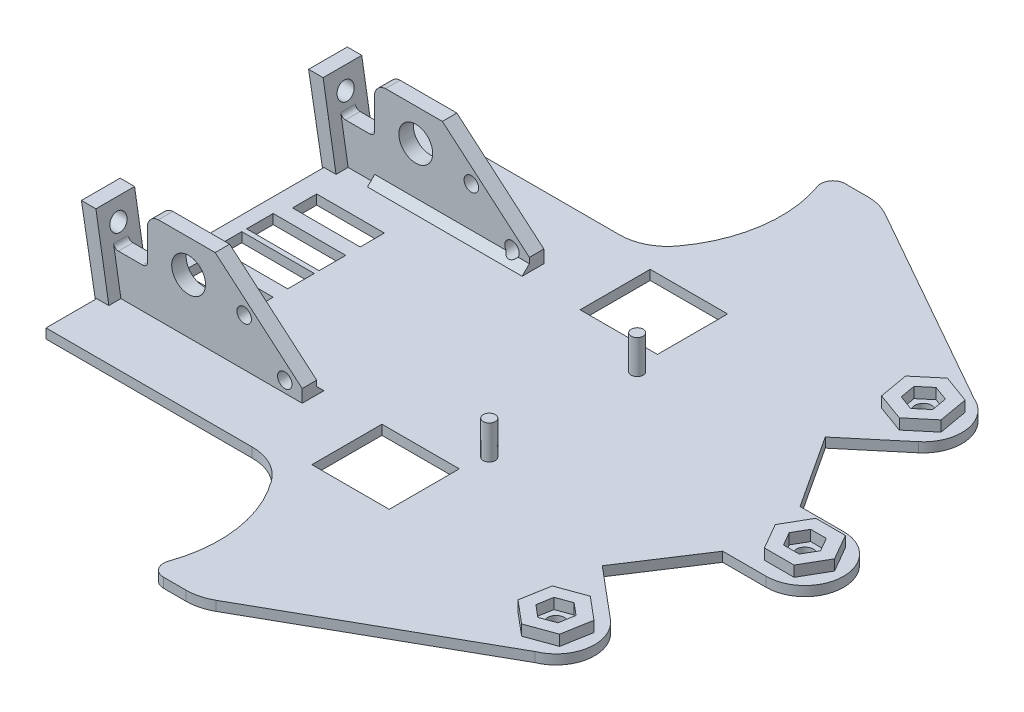
from build123d import *

# Parameters (mm, degrees)
ESBO_O1_R                  = 1.75
ESBO_O1_W                  = 16
ESBO_O1_H                  = 14.5
RESSALTO_EXTRUS_O1_DEPTH   = 2
RESSALTO_EXTRUS_O9_DEPTH   = 2.2
ESBO_O3_W                  = 2.5
ESBO_O3_H                  = 8
RESSALTO_EXTRUS_O3_DEPTH   = 9
ESBO_O3_3_W                = 2.5
ESBO_O3_3_H                = 8
RESSALTO_EXTRUS_O7_DEPTH   = 16
RESSALTO_EXTRUS_O8_DEPTH   = 8
RESSALTO_EXTRUS_O10_DEPTH  = 8
RESSALTO_EXTRUS_O4_START   = -16
ESBO_O4_R                  = 3.5
ESBO_O4_R_2                = 1.5
RESSALTO_EXTRUS_O4_DEPTH   = 3
CHANFRO1_SIZE              = 1.5
RESSALTO_EXTRUS_O15_DEPTH  = 2
FILETE2_R                  = 2.5
CHANFRO1_OF_ESPELHAR1_SIZE = 1.5
FILETE2_OF_ESPELHAR1_R     = 2.5
FILETE3_R                  = 10
CORTE_EXTRUS_O1_REACH      = 146.466
ESBO_O6_R                  = 1.75
CORTE_EXTRUS_O3_DEPTH      = 8
CORTE_EXTRUS_O4_DEPTH      = 8
RESSALTO_EXTRUS_O14_REACH  = 141.754
ESBO_O18_W                 = 3
ESBO_O18_H                 = 8.25
FILETE1_R                  = 1
ESBO_O8_R                  = 1.25
RESSALTO_EXTRUS_O6_DEPTH   = 7
CORTE_EXTRUS_O2_REACH      = 148.367
ESBO_O9_W                  = 14
ESBO_O9_H                  = 5
ESBO_O9_W_2                = 15
ESBO_O9_H_2                = 5.5
ESBO_O20_W                 = 2.5
ESBO_O20_H                 = 9
CORTE_EXTRUS_O5_DEPTH      = 31


with BuildPart() as part:
    # Esboço1 → Ressalto-extrusão1 (new body)
    with BuildSketch(Plane(origin=(0, 0, 0), x_dir=(1, 0, 0), z_dir=(0, 1, 0))):
        with BuildLine():
            Line((93.054209385, 38), (0, 38))
            Line((0, 38), (0, -38))
            Line((0, -38), (93.054209385, -38))
            Line((93.054209385, -38), (100.357699123, -44.128355545))
            ThreePointArc((100.357699123, -44.128355545), (111.628355545, -43.142300877), (110.642300877, -31.871644455))
            Line((110.642300877, -31.871644455), (100.149693398, -23.067301389))
            Line((100.149693398, -23.067301389), (110, -8))
            Line((110, -8), (119, -8))
            ThreePointArc((119, -8), (127, 0), (119, 8))
            Line((119, 8), (110, 8))
            Line((110, 8), (100.148586591, 23.066372668))
            Line((100.148586591, 23.066372668), (110.642300877, 31.871644455))
            ThreePointArc((110.642300877, 31.871644455), (111.628355545, 43.142300877), (100.357699123, 44.128355545))
            Line((100.357699123, 44.128355545), (93.054209385, 38))
        make_face()
        with Locations(Location((105.5, -38, 0), (0, 0, 270))):
            Circle(ESBO_O1_R, mode=Mode.SUBTRACT)
        with Locations(Location((105.5, 38, 0), (0, 0, 270))):
            Circle(ESBO_O1_R, mode=Mode.SUBTRACT)
        with Locations(Location((119, 0, 0), (0, 0, 270))):
            Circle(ESBO_O1_R, mode=Mode.SUBTRACT)
        with Locations((60, -27.75)):
            Rectangle(ESBO_O1_W, ESBO_O1_H, mode=Mode.SUBTRACT)
        with Locations((60, 27.75)):
            Rectangle(ESBO_O1_W, ESBO_O1_H, mode=Mode.SUBTRACT)
    extrude(amount=RESSALTO_EXTRUS_O1_DEPTH)

    # Esboço11 → Ressalto-extrusão9 (add)
    # profile 1 of 3: a face of its own
    with BuildSketch(Plane(origin=(0, 2, 0), x_dir=(1, 0, 0), z_dir=(0, 1, 0))):
        Polygon((99.738312416, -40.09708278), (104.435283169, -44.038309206), (110.196970753, -41.941226427), (111.261687584, -35.90291722), (106.564716831, -31.961690794), (100.803029247, -34.058773573), align=None)
        Polygon((107.985590926, -40.085658429), (108.549028646, -36.890244329), (106.06343772, -34.8045859), (103.014409074, -35.914341571), (102.450971354, -39.109755671), (104.93656228, -41.1954141), align=None, mode=Mode.SUBTRACT)
    # profile 2 of 3: a face of its own
    with BuildSketch(Plane(origin=(0, 2, 0), x_dir=(1, 0, 0), z_dir=(0, 1, 0))):
        Polygon((115.934270071, -5.31), (122.065729929, -5.31), (125.131459859, 0), (122.065729929, 5.31), (115.934270071, 5.31), (112.868540141, 0), align=None)
        Polygon((122.244708513, 0), (120.622354256, 2.81), (117.377645744, 2.81), (115.755291487, 0), (117.377645744, -2.81), (120.622354256, -2.81), align=None, mode=Mode.SUBTRACT)
    # profile 3 of 3: a face of its own
    with BuildSketch(Plane(origin=(0, 2, 0), x_dir=(1, 0, 0), z_dir=(0, 1, 0))):
        Polygon((100.803029247, 34.058773573), (106.564716831, 31.961690794), (111.261687584, 35.90291722), (110.196970753, 41.941226427), (104.435283169, 44.038309206), (99.738312416, 40.09708278), align=None)
        Polygon((107.985590926, 40.085658429), (104.93656228, 41.1954141), (102.450971354, 39.109755671), (103.014409074, 35.914341571), (106.06343772, 34.8045859), (108.549028646, 36.890244329), align=None, mode=Mode.SUBTRACT)
    extrude(amount=RESSALTO_EXTRUS_O9_DEPTH)

    # Esboço3 → Ressalto-extrusão3 (add)
    with BuildSketch(Plane(origin=(0, 2, 0), x_dir=(1, 0, 0), z_dir=(0, 1, 0))):
        with Locations((1.25, -11.5)):
            Rectangle(ESBO_O3_W, ESBO_O3_H)
        with Locations((1.25, 11.5)):
            Rectangle(ESBO_O3_W, ESBO_O3_H)
    extrude(amount=RESSALTO_EXTRUS_O3_DEPTH)

    # Esboço3<3> → Ressalto-extrusão7 (add)
    with BuildSketch(Plane(origin=(0, 2, 0), x_dir=(1, 0, 0), z_dir=(0, 1, 0))):
        with Locations((1.25, -23.5)):
            Rectangle(ESBO_O3_3_W, ESBO_O3_3_H)
        with Locations((1.25, 23.5)):
            Rectangle(ESBO_O3_3_W, ESBO_O3_3_H)
    extrude(amount=RESSALTO_EXTRUS_O7_DEPTH)

    # Esboço10 → Ressalto-extrusão8 (add)
    with BuildSketch(Plane(origin=(0, 0, 19.5), x_dir=(-1, 0, 0), z_dir=(0, 0, -1))):
        Polygon((0, 18), (0, 0), (3.173885653, 18), align=None)
    extrude(amount=-RESSALTO_EXTRUS_O8_DEPTH)

    # Esboço12 → Ressalto-extrusão10 (add)
    with BuildSketch(Plane.XY.offset(-19.5)):
        Polygon((0, 18), (-3.173885653, 18), (0, 0), align=None)
    extrude(amount=-RESSALTO_EXTRUS_O10_DEPTH)

    # Esboço4 → Ressalto-extrusão4 (add)
    with BuildSketch(Plane.XY.offset(38).offset(RESSALTO_EXTRUS_O4_START)):
        with BuildLine():
            Line((22, 20), (40, 4.635674992))
            Line((40, 4.635674992), (40, 2))
            Line((40, 2), (8, 2))
            Line((8, 2), (8, 16.996816315))
            ThreePointArc((8, 16.996816315), (8.443232576, 19.003434084), (10.240404344, 20))
            Line((10.240404344, 20), (22, 20))
        make_face()
        with Locations((16.5, 13.25)):
            Circle(ESBO_O4_R, mode=Mode.SUBTRACT)
        with Locations((28, 11.801092343)):
            Circle(ESBO_O4_R_2, mode=Mode.SUBTRACT)
        with Locations((36.4, 4.34)):
            Circle(ESBO_O4_R_2, mode=Mode.SUBTRACT)
    ressalto_extrus_o4 = extrude(amount=RESSALTO_EXTRUS_O4_DEPTH)

    # Chanfro1
    # the kernel refuses this chamfer: 1.5 mm, written as the material it adds along each edge
    with BuildSketch(Plane(origin=(40, 2, 22), x_dir=(0, -0.027495876610586334, -0.9996219169112968), z_dir=(-1, 0, 0))) as chanfro1_piece_1_section:
        Polygon((CHANFRO1_SIZE * 0.999621916911, -CHANFRO1_SIZE * 0.0274958766106), (-CHANFRO1_SIZE * 0.0274958766106, -CHANFRO1_SIZE * 0.999621916911), (0, 0), align=None)
    chanfro1_piece_1 = extrude(amount=32, mode=Mode.PRIVATE)
    chanfro1_piece_1 = chanfro1_piece_1 - Plane(origin=(36.4, 4.34, 21.50204414), x_dir=(1, 0, 0), z_dir=(0, 0, -1)) * Cylinder(1.5, 70, mode=Mode.PRIVATE)
    add(chanfro1_piece_1)

    # Esboço21 → Ressalto-extrusão15 (add)
    with BuildSketch(Plane(origin=(0, 2, 0), x_dir=(1, 0, 0), z_dir=(0, 1, 0))):
        with BuildLine():
            Line((53, -70.5), (64.093204136, -70.5))
            Line((64.093204136, -70.5), (108.561481673, -45.391030373))
            Line((108.561481673, -45.391030373), (103.358833516, -45.391030373))
            Line((103.358833516, -45.391030373), (95.364049773, -38))
            Line((95.364049773, -38), (47, -38))
            ThreePointArc((47, -38), (55.553461033, -53.224745655), (53, -70.5))
        make_face()
    ressalto_extrus_o15 = extrude(amount=-RESSALTO_EXTRUS_O15_DEPTH)

    # Filete2
    filete2_edges = [part.edges().sort_by_distance(p)[0] for p in [
        (53, 1, 70.5),
    ]]
    fillet(filete2_edges, radius=FILETE2_R)

    # Espelhar1: Ressalto-extrusão4, Ressalto-extrusão15 across plane
    add(ressalto_extrus_o4.mirror(Plane.XY))
    add(ressalto_extrus_o15.mirror(Plane.XY))

    # Chanfro1 of Espelhar1
    # the kernel refuses this chamfer: 1.5 mm, written as the material it adds along each edge
    with BuildSketch(Plane(origin=(40, 2, -22), x_dir=(0, -0.027495876610586334, 0.9996219169112968), z_dir=(-1, 0, 0))) as chanfro1_of_espelhar1_piece_1_section:
        Polygon((CHANFRO1_OF_ESPELHAR1_SIZE * 0.999621916911, CHANFRO1_OF_ESPELHAR1_SIZE * 0.0274958766106), (-CHANFRO1_OF_ESPELHAR1_SIZE * 0.0274958766106, CHANFRO1_OF_ESPELHAR1_SIZE * 0.999621916911), (0, 0), align=None)
    chanfro1_of_espelhar1_piece_1 = extrude(amount=32, mode=Mode.PRIVATE)
    chanfro1_of_espelhar1_piece_1 = chanfro1_of_espelhar1_piece_1 - Plane(origin=(36.4, 4.34, -21.50204414), x_dir=(1, 0, 0), z_dir=(0, 0, 1)) * Cylinder(1.5, 70, mode=Mode.PRIVATE)
    add(chanfro1_of_espelhar1_piece_1)

    # Filete2 of Espelhar1
    filete2_of_espelhar1_edges = [part.edges().sort_by_distance(p)[0] for p in [
        (53, 1, -70.5),
    ]]
    fillet(filete2_of_espelhar1_edges, radius=FILETE2_OF_ESPELHAR1_R)

    # Filete3
    filete3_edges = [part.edges().sort_by_distance(p)[0] for p in [
        (47, 1, 38),
        (64.093204136, 1, 70.5),
        (47, 1, -38),
        (64.093204136, 1, -70.5),
    ]]
    fillet(filete3_edges, radius=FILETE3_R)

    # Esboço6 → Corte-extrusão1 (cut, up to next)
    with BuildSketch(Plane.ZY.offset(-2.5), mode=Mode.PRIVATE) as corte_extrus_o1_sk1:
        with Locations(Location((11.5, 7, 0), (0, 0, 180))):
            Circle(ESBO_O6_R)
    corte_extrus_o1_tool1 = extrude(corte_extrus_o1_sk1.sketch, amount=CORTE_EXTRUS_O1_REACH, mode=Mode.PRIVATE) & part.part
    # Esboço6 → Corte-extrusão1 (cut, up to next)
    with BuildSketch(Plane.ZY.offset(-2.5), mode=Mode.PRIVATE) as corte_extrus_o1_sk2:
        with Locations(Location((23.5, 14, 0), (0, 0, 270))):
            Circle(ESBO_O6_R)
    corte_extrus_o1_tool2 = extrude(corte_extrus_o1_sk2.sketch, amount=CORTE_EXTRUS_O1_REACH, mode=Mode.PRIVATE) & part.part
    corte_extrus_o1_1 = corte_extrus_o1_tool1.solids().sort_by_distance((2.5, 7, 11.5))[0]
    add(corte_extrus_o1_1, mode=Mode.SUBTRACT)
    corte_extrus_o1_2 = corte_extrus_o1_tool2.solids().sort_by_distance((2.5, 14, 23.5))[0]
    add(corte_extrus_o1_2, mode=Mode.SUBTRACT)
    corte_extrus_o1 = corte_extrus_o1_1 + corte_extrus_o1_2  # Corte-extrusão1 as one shape, for the pattern or mirror that repeats it

    # Esboço15 → Corte-extrusão3 (cut)
    with BuildSketch(Plane.XY.offset(27.5)):
        Polygon((-0.173885653, 18), (2.5, 18), (2.5, 2), align=None)
    extrude(amount=-CORTE_EXTRUS_O3_DEPTH, mode=Mode.SUBTRACT)

    # Esboço16 → Corte-extrusão4 (cut)
    with BuildSketch(Plane(origin=(0, 0, -27.5), x_dir=(-1, 0, 0), z_dir=(0, 0, -1))):
        Polygon((-2.5, 18), (0.173885653, 18), (-2.5, 2), align=None)
    extrude(amount=-CORTE_EXTRUS_O4_DEPTH, mode=Mode.SUBTRACT)

    # Ressalto-extrusão14: up to this plane
    ressalto_extrus_o14_end = Plane(origin=(2.5, 2, 3.278111562), z_dir=(-0.9863216641813338, -0.1648319591783229, 0))
    # Esboço18 → Ressalto-extrusão14 (add, up to the surface)
    with BuildSketch(Plane.ZY.offset(-8), mode=Mode.PRIVATE) as ressalto_extrus_o14_sk1:
        with Locations((23.5, 6.125)):
            Rectangle(ESBO_O18_W, ESBO_O18_H)
    ressalto_extrus_o14_tool1 = split(extrude(ressalto_extrus_o14_sk1.sketch, amount=RESSALTO_EXTRUS_O14_REACH, mode=Mode.PRIVATE), bisect_by=ressalto_extrus_o14_end, keep=Keep.BOTH, mode=Mode.PRIVATE)
    ressalto_extrus_o14 = ressalto_extrus_o14_tool1.solids().sort_by_distance((8, 6.125, 23.5))[0]
    add(ressalto_extrus_o14)

    # Espelhar2: Corte-extrusão1, Ressalto-extrusão14 across plane
    add(corte_extrus_o1.mirror(Plane.XY), mode=Mode.SUBTRACT)
    add(ressalto_extrus_o14.mirror(Plane.XY))

    # Filete1
    filete1_edges = [part.edges().sort_by_distance(p)[0] for p in [
        (8, 10.25, 23.5),
        (1.12127771, 10.25, 23.5),
        (8, 10.25, -23.5),
        (1.12127771, 10.25, -23.5),
    ]]
    fillet(filete1_edges, radius=FILETE1_R)

    # Esboço8 → Ressalto-extrusão6 (add)
    with BuildSketch(Plane(origin=(0, 2, 0), x_dir=(1, 0, 0), z_dir=(0, 1, 0))):
        with Locations(Location((69, -15.3, 0), (0, 0, 90))):
            Circle(ESBO_O8_R)
        with Locations(Location((69, 15.3, 0), (0, 0, 90))):
            Circle(ESBO_O8_R)
    extrude(amount=RESSALTO_EXTRUS_O6_DEPTH)

    # Esboço9 → Corte-extrusão2 (cut, up to next)
    with BuildSketch(Plane(origin=(0, 2, 0), x_dir=(1, 0, 0), z_dir=(0, 1, 0)), mode=Mode.PRIVATE) as corte_extrus_o2_sk1:
        with Locations((11, -11.5)):
            Rectangle(ESBO_O9_W, ESBO_O9_H)
    corte_extrus_o2_tool1 = extrude(corte_extrus_o2_sk1.sketch, amount=-CORTE_EXTRUS_O2_REACH, mode=Mode.PRIVATE) & part.part
    # Esboço9 → Corte-extrusão2 (cut, up to next)
    with BuildSketch(Plane(origin=(0, 2, 0), x_dir=(1, 0, 0), z_dir=(0, 1, 0)), mode=Mode.PRIVATE) as corte_extrus_o2_sk2:
        with Locations((10.5, -3.25)):
            Rectangle(ESBO_O9_W_2, ESBO_O9_H_2)
    corte_extrus_o2_tool2 = extrude(corte_extrus_o2_sk2.sketch, amount=-CORTE_EXTRUS_O2_REACH, mode=Mode.PRIVATE) & part.part
    # Esboço9 → Corte-extrusão2 (cut, up to next)
    with BuildSketch(Plane(origin=(0, 2, 0), x_dir=(1, 0, 0), z_dir=(0, 1, 0)), mode=Mode.PRIVATE) as corte_extrus_o2_sk3:
        with Locations((11, 11.5)):
            Rectangle(ESBO_O9_W, ESBO_O9_H)
    corte_extrus_o2_tool3 = extrude(corte_extrus_o2_sk3.sketch, amount=-CORTE_EXTRUS_O2_REACH, mode=Mode.PRIVATE) & part.part
    # Esboço9 → Corte-extrusão2 (cut, up to next)
    with BuildSketch(Plane(origin=(0, 2, 0), x_dir=(1, 0, 0), z_dir=(0, 1, 0)), mode=Mode.PRIVATE) as corte_extrus_o2_sk4:
        with Locations((10.5, 3.25)):
            Rectangle(ESBO_O9_W_2, ESBO_O9_H_2)
    corte_extrus_o2_tool4 = extrude(corte_extrus_o2_sk4.sketch, amount=-CORTE_EXTRUS_O2_REACH, mode=Mode.PRIVATE) & part.part
    add(corte_extrus_o2_tool1.solids().sort_by_distance((11, 2, 11.5))[0], mode=Mode.SUBTRACT)
    add(corte_extrus_o2_tool2.solids().sort_by_distance((10.5, 2, 3.25))[0], mode=Mode.SUBTRACT)
    add(corte_extrus_o2_tool3.solids().sort_by_distance((11, 2, -11.5))[0], mode=Mode.SUBTRACT)
    add(corte_extrus_o2_tool4.solids().sort_by_distance((10.5, 2, -3.25))[0], mode=Mode.SUBTRACT)

    # Esboço20 → Corte-extrusão5 (cut)
    with BuildSketch(Plane.XY.offset(15.5)):
        with Locations((1.25, 6.5)):
            Rectangle(ESBO_O20_W, ESBO_O20_H)
    extrude(amount=-CORTE_EXTRUS_O5_DEPTH, mode=Mode.SUBTRACT)


solid = part.part
